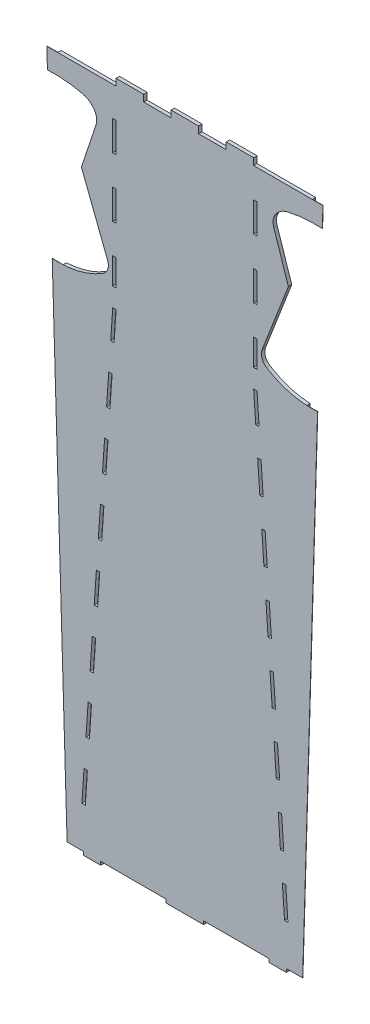
from build123d import *

# Parameters (mm, degrees)
SKETCH1_W           = 10.166490401
SKETCH1_H           = 88.9
BOSS_EXTRUDE1_DEPTH = 10.16
CUT_LOFT1_DEPTH     = 9.5
CUT_EXTRUDE1_DEPTH  = 25.4


# Read off the part's stored shape, not the designer's step: Cut-Loft1
with BuildPart() as part:
    # Sketch1 → Boss-Extrude1 (new body)
    with BuildSketch(Plane.XY):
        Polygon((205.715298803, 2062.48), (123.444, 2062.48), (123.444, 2042.16), (41.135649402, 2042.16), (41.135649402, 2062.48), (-41.135649402, 2062.48), (-41.135649402, 2042.16), (-123.444, 2042.16), (-123.444, 2062.48), (-205.715298803, 2062.48), (-205.715298803, 2042.16), (-413.154415126, 2042.16), (-396.271290337, 1476.636861244), (-352.491097889, 10.16), (-303.52, 10.16), (-303.52, 0), (-252, 0), (-252, 10.16), (-55.8292, 10.16), (-55.8292, 0), (55.8292, 0), (55.8292, 10.16), (252, 10.16), (252, 0), (303.52, 0), (303.52, 10.16), (352.491097889, 10.16), (396.271290337, 1476.636861244), (413.154415126, 2042.16), (205.715298803, 2042.16), align=None)
        Polygon((-308.266124544, 132.94397688), (-301.755453134, 226.680843836), (-291.63777305, 225.978101227), (-298.14844446, 132.241234271), align=None, mode=Mode.SUBTRACT)
        Polygon((-289.435698895, 404.053512688), (-279.318018811, 403.350770078), (-285.830533081, 309.587370692), (-295.948213166, 310.290113301), align=None, mode=Mode.SUBTRACT)
        Polygon((-283.630301787, 487.636249721), (-277.115944656, 581.426181539), (-266.998264572, 580.72343893), (-273.512621703, 486.933507112), align=None, mode=Mode.SUBTRACT)
        Polygon((-264.796190418, 758.798850391), (-254.678510334, 758.096107781), (-261.194710324, 664.279643533), (-271.312390408, 664.982386142), align=None, mode=Mode.SUBTRACT)
        Polygon((-252.476436179, 936.171519242), (-242.358756095, 935.468776633), (-248.876798945, 841.625779953), (-258.99447903, 842.328522563), align=None, mode=Mode.SUBTRACT)
        Polygon((301.755453134, 226.680843836), (308.266124544, 132.94397688), (298.14844446, 132.241234271), (291.63777305, 225.978101227), align=None, mode=Mode.SUBTRACT)
        Polygon((279.318018811, 403.350770078), (289.435698895, 404.053512688), (295.948213166, 310.290113301), (285.830533081, 309.587370692), align=None, mode=Mode.SUBTRACT)
        Polygon((277.115944656, 581.426181539), (283.630301787, 487.636249721), (273.512621703, 486.933507112), (266.998264572, 580.72343893), align=None, mode=Mode.SUBTRACT)
        Polygon((254.678510334, 758.096107781), (264.796190418, 758.798850391), (271.312390408, 664.982386142), (261.194710324, 664.279643533), align=None, mode=Mode.SUBTRACT)
        Polygon((242.358756095, 935.468776633), (252.476436179, 936.171519242), (258.99447903, 842.328522563), (248.876798945, 841.625779953), align=None, mode=Mode.SUBTRACT)
        Polygon((-240.15668194, 1113.544188093), (-230.039001856, 1112.841445484), (-236.558887567, 1018.971916374), (-246.676567651, 1019.674658983), align=None, mode=Mode.SUBTRACT)
        Polygon((-227.836927701, 1290.916856945), (-217.719247617, 1290.214114336), (-224.240976188, 1196.318052795), (-234.358656272, 1197.020795404), align=None, mode=Mode.SUBTRACT)
        Polygon((-205.715298803, 1463.040000035), (-211.92306481, 1373.664189215), (-222.040744894, 1374.366931824), (-215.881789204, 1463.040000035), align=None, mode=Mode.SUBTRACT)
        Polygon((-205.715298803, 1597.66), (-205.715298803, 1518.92), (-215.881789204, 1518.92), (-215.875298803, 1597.66), align=None, mode=Mode.SUBTRACT)
        Polygon((-215.881789204, 1775.46), (-205.715298803, 1775.46), (-205.715298803, 1686.56), (-215.875298803, 1686.56), align=None, mode=Mode.SUBTRACT)
        with Locations((-210.798544004, 1908.81)):
            Rectangle(SKETCH1_W, SKETCH1_H, mode=Mode.SUBTRACT)
        Polygon((230.039001856, 1112.841445484), (240.15668194, 1113.544188093), (246.676567651, 1019.674658983), (236.558887567, 1018.971916374), align=None, mode=Mode.SUBTRACT)
        Polygon((217.719247617, 1290.214114336), (227.836927701, 1290.916856945), (234.358656272, 1197.020795404), (224.240976188, 1196.318052795), align=None, mode=Mode.SUBTRACT)
        Polygon((205.715298803, 1463.040000035), (215.881789204, 1463.040000035), (222.040744894, 1374.366931824), (211.92306481, 1373.664189215), align=None, mode=Mode.SUBTRACT)
        Polygon((205.715298803, 1518.92), (205.715298803, 1597.66), (215.875298803, 1597.66), (215.881789204, 1518.92), align=None, mode=Mode.SUBTRACT)
        Polygon((215.875298803, 1686.56), (205.715298803, 1686.56), (205.715298803, 1775.46), (215.881789204, 1775.46), align=None, mode=Mode.SUBTRACT)
        with Locations((210.798544004, 1908.81)):
            Rectangle(SKETCH1_W, SKETCH1_H, mode=Mode.SUBTRACT)
    extrude(amount=BOSS_EXTRUDE1_DEPTH)

    # Cut-Loft1 outline → Cut-Loft1 (cut)
    with BuildSketch(Plane.XY):
        Polygon((413.154415126, 2042.16), (381.028592831, 2042.16), (320.021789204, 10.16), (352.491097889, 10.16), align=None)
    cut_loft1 = extrude(amount=CUT_LOFT1_DEPTH, mode=Mode.SUBTRACT)

    # Mirror1: Cut-Loft1 across plane
    add(cut_loft1.mirror(Plane(origin=(0, 0, 0), x_dir=(0, 0, 1), z_dir=(1, 0, 0))), mode=Mode.SUBTRACT)

    # Sketch5 → Cut-Extrude1 (cut)
    with BuildSketch(Plane.XY.offset(10.16)):
        with BuildLine():
            Line((-309.664998773, 1780.395782343), (-265.952588541, 1911.802778537))
            ThreePointArc((-265.952588541, 1911.802778537), (-264.206620212, 1930.321698349), (-270.763848637, 1947.728638108))
            ThreePointArc((-270.763848637, 1947.728638108), (-286.026753768, 1963.338738872), (-305.933283146, 1972.30320244))
            ThreePointArc((-305.933283146, 1972.30320244), (-373.738136291, 1981.836524353), (-442.111254245, 1978.162415213))
            ThreePointArc((-442.111254245, 1978.162415213), (-464.015066469, 1972.611243238), (-483.4565367, 1961.09509217))
            ThreePointArc((-483.4565367, 1961.09509217), (-490.90037063, 1952.015537044), (-494.085205077, 1940.714837314))
            ThreePointArc((-494.085205077, 1940.714837314), (-493.113582775, 1918.584031361), (-487.226155437, 1897.228591273))
            Line((-487.226155437, 1897.228591273), (-440.006038151, 1779.541506735))
            Line((-440.006038151, 1779.541506735), (-444.869952003, 1766.787584771))
            Line((-444.869952003, 1766.787584771), (-499.250120406, 1562.442369228))
            ThreePointArc((-499.250120406, 1562.442369228), (-501.002060754, 1550.034969303), (-499.759073304, 1537.566294552))
            ThreePointArc((-499.759073304, 1537.566294552), (-497.045740968, 1531.687225415), (-492.143646285, 1527.456966086))
            ThreePointArc((-492.143646285, 1527.456966086), (-491.585215906, 1527.158540923), (-491.022106504, 1526.869041585))
            ThreePointArc((-491.022106504, 1526.869041585), (-435.60976827, 1506.600715364), (-377.018264457, 1499.646007808))
            ThreePointArc((-377.018264457, 1499.646007808), (-308.245951106, 1509.249866694), (-244.842202975, 1537.566468046))
            ThreePointArc((-244.842202975, 1537.566468046), (-230.724010197, 1555.568862278), (-231.297825955, 1578.43981112))
            Line((-231.297825955, 1578.43981112), (-309.664998773, 1780.395782343))
        make_face()
        with BuildLine():
            Line((440.006038151, 1779.541506735), (487.226155437, 1897.228591273))
            ThreePointArc((487.226155437, 1897.228591273), (493.113582775, 1918.584031361), (494.085205077, 1940.714837314))
            ThreePointArc((494.085205077, 1940.714837314), (490.90037063, 1952.015537044), (483.4565367, 1961.09509217))
            ThreePointArc((483.4565367, 1961.09509217), (464.015066469, 1972.611243238), (442.111254245, 1978.162415213))
            ThreePointArc((442.111254245, 1978.162415213), (373.738136291, 1981.836524353), (305.933283146, 1972.30320244))
            ThreePointArc((305.933283146, 1972.30320244), (286.026753768, 1963.338738872), (270.763848637, 1947.728638108))
            ThreePointArc((270.763848637, 1947.728638108), (264.206620212, 1930.321698349), (265.952588541, 1911.802778537))
            Line((265.952588541, 1911.802778537), (309.664998773, 1780.395782343))
            Line((309.664998773, 1780.395782343), (231.297825955, 1578.43981112))
            ThreePointArc((231.297825955, 1578.43981112), (230.724010197, 1555.568862278), (244.842202975, 1537.566468046))
            ThreePointArc((244.842202975, 1537.566468046), (308.245951106, 1509.249866694), (377.018264457, 1499.646007808))
            ThreePointArc((377.018264457, 1499.646007808), (435.60976827, 1506.600715364), (491.022106504, 1526.869041585))
            ThreePointArc((491.022106504, 1526.869041585), (491.585215906, 1527.158540923), (492.143646285, 1527.456966086))
            ThreePointArc((492.143646285, 1527.456966086), (497.045740968, 1531.687225415), (499.759073304, 1537.566294552))
            ThreePointArc((499.759073304, 1537.566294552), (501.002060754, 1550.034969303), (499.250120406, 1562.442369228))
            Line((499.250120406, 1562.442369228), (444.869952003, 1766.787584771))
            Line((444.869952003, 1766.787584771), (440.006038151, 1779.541506735))
        make_face()
    extrude(amount=-CUT_EXTRUDE1_DEPTH, mode=Mode.SUBTRACT)


solid = part.part
